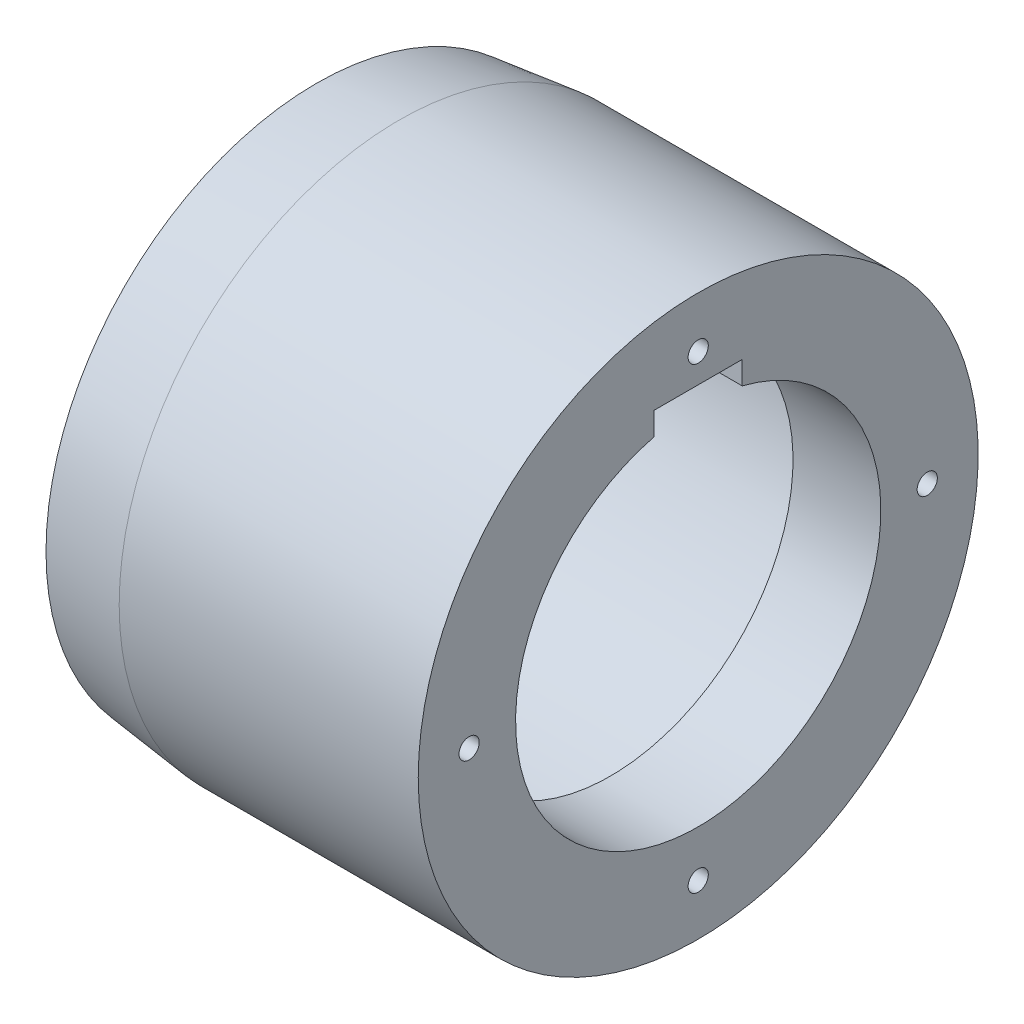
from build123d import *

# Parameters (mm, degrees)
SKETCH2_R          = 1.5875
CUT_EXTRUDE1_DEPTH = 20
SKETCH3_W          = 13.840656802
SKETCH3_H          = 5.513517444
CUT_EXTRUDE2_DEPTH = 20


with BuildPart() as part:
    # Sketch1 → Revolve1 (revolve)
    with BuildSketch(Plane.XY):
        Polygon((13, 44), (60, 44), (60, 28.702), (46.198291451, 28.702), (46.198291451, 36), (46.198291451, 41.08072399), (40, 41.08072399), (40, 42.5), (0, 42.5), align=None)
    revolve(axis=Axis((0, 0, 0), (1, 0, 0)))

    # Sketch2 → Cut-Extrude1 (cut)
    with BuildSketch(Plane(origin=(60, 0, 0), x_dir=(0, 0, -1), z_dir=(1, 0, 0))):
        with Locations((-36, 0)):
            Circle(SKETCH2_R)
        with Locations((0, 36)):
            Circle(SKETCH2_R)
        with Locations((36, 0)):
            Circle(SKETCH2_R)
        with Locations((0, -36)):
            Circle(SKETCH2_R)
    extrude(amount=-CUT_EXTRUDE1_DEPTH, mode=Mode.SUBTRACT)

    # Sketch3 → Cut-Extrude2 (cut)
    with BuildSketch(Plane.ZY.offset(-46.198291451)):
        with Locations((0, 28.702)):
            Rectangle(SKETCH3_W, SKETCH3_H)
    extrude(amount=-CUT_EXTRUDE2_DEPTH, mode=Mode.SUBTRACT)


solid = part.part
